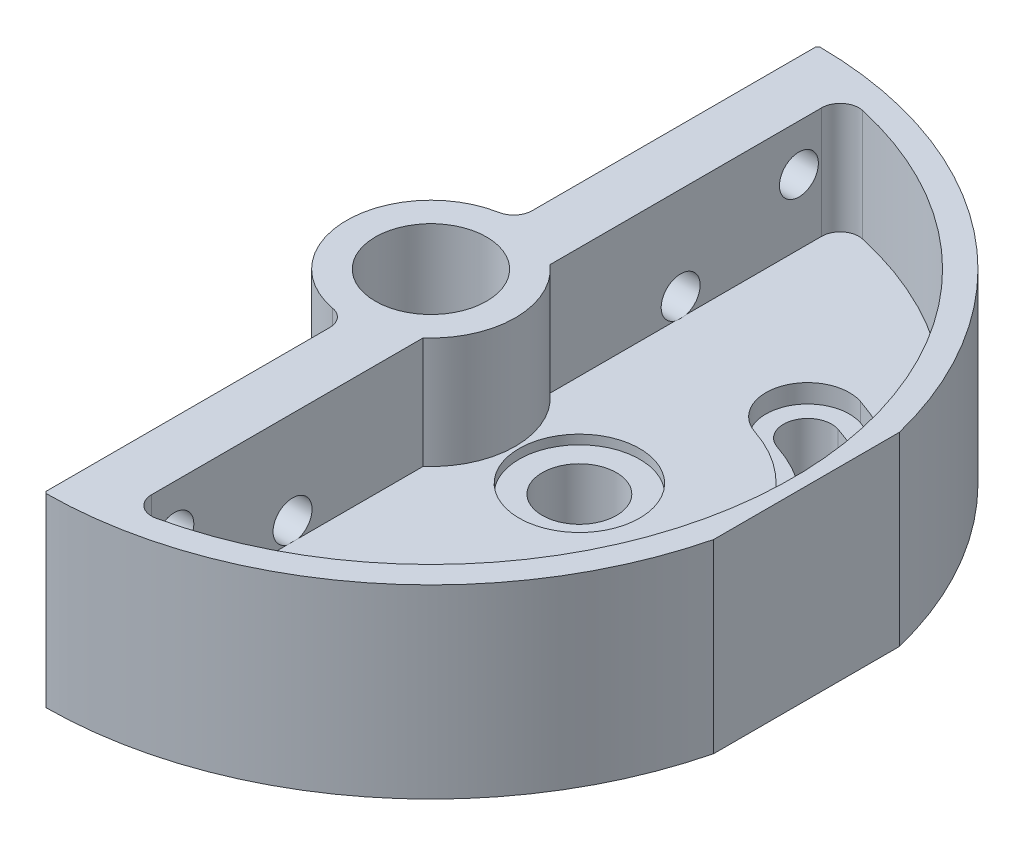
from build123d import *

# Parameters (mm, degrees)
SKETCH_1_R               = 6
EXTRUDE_1_DEPTH          = 20
SKETCH_2_R               = 6.1
EXTRUDE_2_DEPTH          = 11
SKETCH_3_R               = 3.4
CUT_EXTRUDE_1_DEPTH      = 60.989832472
CUT_EXTRUDE_5_DEPTH      = 63.271823484
CUT_EXTRUDE_START        = -12
CUT_EXTRUDE_6_DEPTH      = 12
SKETCH_12_R              = 4
CUT_EXTRUDE_7_DEPTH      = 60.344586948
SKETCH_13_R              = 6.5
CUT_EXTRUDE_8_DEPTH      = 1
CUT_EXTRUDE_9_DEPTH      = 60.344586948
CUT_EXTRUDE_9_DEPTH_BACK = 60.344586948
CUT_EXTRUDE_10_DEPTH     = 2
CHAMFER_1_SIZE           = 0.2
M5X0_8_2_OUTLINE_R       = 2.1
M5X0_8_2_DEPTH           = 6
M5X0_8_2_2_OUTLINE_W     = 1.999932927
M5X0_8_2_2_OUTLINE_H     = 6.060126363


# Read off the part's stored shape, not the designer's step: M5x0.8 螺纹孔2
with BuildPart() as part:
    # 草图1 → 凸台-拉伸1 (new body)
    with BuildSketch(Plane(origin=(0, 0, 0), x_dir=(1, 0, 0), z_dir=(0, 1, 0))):
        with BuildLine():
            Line((0, 41.7), (0, 10.918333206))
            ThreePointArc((0, 10.918333206), (-0.463653568, 9.637849063), (-1.63963964, 8.951065962))
            ThreePointArc((-1.63963964, 8.951065962), (-9.1, 0), (-1.63963964, -8.951065962))
            ThreePointArc((-1.63963964, -8.951065962), (-0.463653568, -9.637849063), (0, -10.918333206))
            Line((0, -10.918333206), (0, -41.7))
            ThreePointArc((0, -41.7), (41.7, 0), (0, 41.7))
        make_face()
        with Locations(Location((0, 0, 0), (0, 0, 270))):
            Circle(SKETCH_1_R, mode=Mode.SUBTRACT)
    extrude(amount=EXTRUDE_1_DEPTH)

    # 草图2 → 凸台-拉伸2 (add)
    with BuildSketch(Plane.XZ):
        Circle(SKETCH_2_R)
    extrude(amount=-EXTRUDE_2_DEPTH)

    # 草图3 → 切除-拉伸1 (cut, through all)
    with BuildSketch(Plane(origin=(0, 11, 0), x_dir=(1, 0, 0), z_dir=(0, 1, 0))):
        with Locations(Location((0, 0, 0), (0, 0, 270))):
            Circle(SKETCH_3_R)
    extrude(amount=-CUT_EXTRUDE_1_DEPTH, mode=Mode.SUBTRACT)

    # 草图10 → 切除-拉伸5 (cut, through all)
    with BuildSketch(Plane.XZ):
        with BuildLine():
            Line((40.483206395, 10), (40.483206395, -10))
            ThreePointArc((40.483206395, -10), (41.394683878, -5.036878663), (41.7, 0))
            ThreePointArc((41.7, 0), (41.394683878, 5.036878663), (40.483206395, 10))
        make_face()
    extrude(amount=-CUT_EXTRUDE_5_DEPTH, mode=Mode.SUBTRACT)

    # 草图11 → 切除-拉伸6 (cut)
    with BuildSketch(Plane(origin=(0, 20, 0), x_dir=(1, 0, 0), z_dir=(0, 1, 0)).offset(CUT_EXTRUDE_START)):
        with BuildLine():
            Line((6, -36.124783736), (6, -6.841783393))
            ThreePointArc((6, -6.841783393), (9.1, 0), (6, 6.841783393))
            Line((6, 6.841783393), (6, 36.124783736))
            ThreePointArc((6, 36.124783736), (6.747974614, 37.684409471), (8.432432432, 38.077474749))
            ThreePointArc((8.432432432, 38.077474749), (39, 0), (8.432432432, -38.077474749))
            ThreePointArc((8.432432432, -38.077474749), (6.747974614, -37.684409471), (6, -36.124783736))
        make_face()
    extrude(amount=CUT_EXTRUDE_6_DEPTH, mode=Mode.SUBTRACT)

    # 草图12 → 切除-拉伸7 (cut, through all)
    with BuildSketch(Plane(origin=(0, 8, 0), x_dir=(1, 0, 0), z_dir=(0, 1, 0))):
        with Locations(Location((16, 0, 0), (0, 0, 270))):
            Circle(SKETCH_12_R)
    extrude(amount=-CUT_EXTRUDE_7_DEPTH, mode=Mode.SUBTRACT)

    # 草图13 → 切除-拉伸8 (cut)
    with BuildSketch(Plane(origin=(0, 8, 0), x_dir=(1, 0, 0), z_dir=(0, 1, 0))):
        with Locations(Location((16, 0, 0), (0, 0, 270))):
            Circle(SKETCH_13_R)
    extrude(amount=-CUT_EXTRUDE_8_DEPTH, mode=Mode.SUBTRACT)

    # 草图14 → 切除-拉伸9 (cut, two sides: drawn at the far end of the back side and taken through both)
    with BuildSketch(Plane(origin=(0, 8, 0), x_dir=(1, 0, 0), z_dir=(0, 1, 0)).offset(-CUT_EXTRUDE_9_DEPTH_BACK)):
        with BuildLine():
            ThreePointArc((22.891243611, 20.998113284), (30.339314214, 16.81648203), (35.645345475, 10.122766478))
            ThreePointArc((35.645345475, 10.122766478), (34.525042064, 6.62063566), (31.022911246, 7.740939071))
            ThreePointArc((31.022911246, 7.740939071), (26.965357928, 12.859662729), (21.269774526, 16.057380747))
            ThreePointArc((21.269774526, 16.057380747), (19.6101428, 19.338481558), (22.891243611, 20.998113284))
        make_face()
    extrude(amount=CUT_EXTRUDE_9_DEPTH + CUT_EXTRUDE_9_DEPTH_BACK, mode=Mode.SUBTRACT)

    # 草图15 → 切除-拉伸10 (cut)
    with BuildSketch(Plane(origin=(0, 8, 0), x_dir=(1, 0, 0), z_dir=(0, 1, 0))):
        with BuildLine():
            ThreePointArc((37.334311828, 10.993049569), (31.572105933, 18.262242929), (23.483703469, 22.803380942))
            ThreePointArc((23.483703469, 22.803380942), (17.804875142, 19.930941416), (20.677314668, 14.252113089))
            ThreePointArc((20.677314668, 14.252113089), (25.732566208, 11.413901831), (29.333944893, 6.87065598))
            ThreePointArc((29.333944893, 6.87065598), (35.395325154, 4.931669307), (37.334311828, 10.993049569))
        make_face()
    extrude(amount=-CUT_EXTRUDE_10_DEPTH, mode=Mode.SUBTRACT)

    # 倒角1
    chamfer_1_edges = [part.edges().sort_by_distance(p)[0] for p in [
        (0, 10, 41.7),
        (0, 10, -41.7),
    ]]
    chamfer(chamfer_1_edges, length=CHAMFER_1_SIZE)

    # M5x0.8 螺纹孔2 outline → M5x0.8 螺纹孔2 (cut)
    with BuildSketch(Plane.YZ):
        with Locations((15, -33.667083302)):
            Circle(M5X0_8_2_OUTLINE_R)
        with Locations((10, 20.918333206)):
            Circle(M5X0_8_2_OUTLINE_R)
        with Locations((15, 33.667083302)):
            Circle(M5X0_8_2_OUTLINE_R)
    extrude(amount=M5X0_8_2_DEPTH, mode=Mode.SUBTRACT)

    # M5x0.8 _2 2 outline → M5x0.8 _2 2 (revolve, cut)
    with BuildSketch(Plane(origin=(0, 10, -20.918333206), x_dir=(0, 1, 0), z_dir=(0, 0, -1))):
        with Locations((0.999966464, 3.030063182)):
            Rectangle(M5X0_8_2_2_OUTLINE_W, M5X0_8_2_2_OUTLINE_H)
        Polygon((2.100006439, 5.999996131), (1.999932927, 6.060126363), (1.999932927, 0), (2.100006439, 0), align=None)
    revolve(axis=Axis((0, 10, -20.918333206), (1, 0, 0)), mode=Mode.SUBTRACT)


solid = part.part
